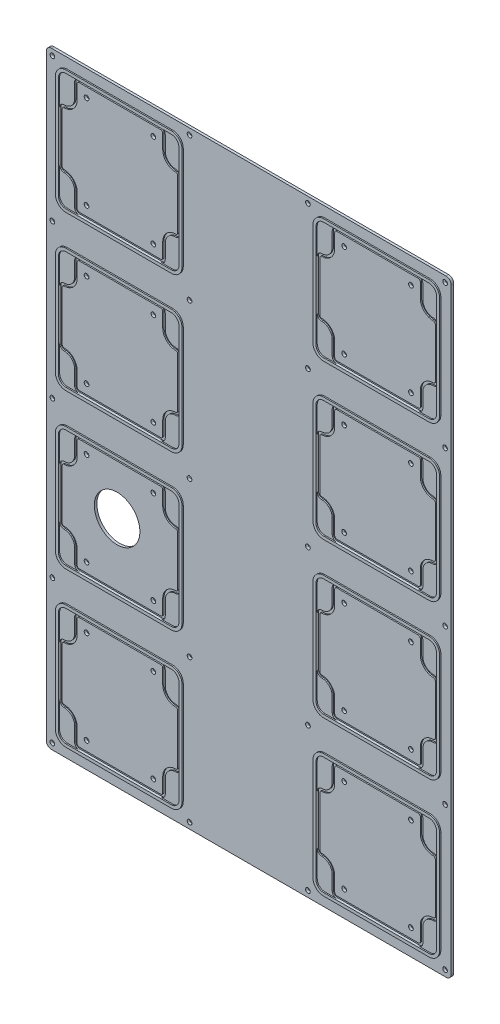
from build123d import *

# Parameters (mm, degrees)
SKETCH1_W            = 254
SKETCH1_H            = 381
BOSS_EXTRUDE1_DEPTH  = 1.5875
SKETCH2_R            = 1.4732
CUT_EXTRUDE1_DEPTH   = 458.907763809
FILLET1_R            = 3.175
CUT_EXTRUDE2_DEPTH   = 0.79375
BOSS_EXTRUDE2_DEPTH  = 0.79375
SKETCH5_R            = 1.4732
CUT_EXTRUDE3_DEPTH   = 458.907763809
LPATTERN1_COUNT      = 4
LPATTERN1_PITCH      = 96.8756
LPATTERN1_COUNT_DIR2 = 2
LPATTERN1_PITCH_DIR2 = 161.5948
SKETCH6_R            = 14.2875
CUT_EXTRUDE4_DEPTH   = 2.54


with BuildPart() as part:
    # Sketch1 → Boss-Extrude1 (new body)
    with BuildSketch(Plane.XY):
        with Locations((127, 190.5)):
            Rectangle(SKETCH1_W, SKETCH1_H)
    extrude(amount=BOSS_EXTRUDE1_DEPTH)

    # Sketch2 → Cut-Extrude1 (cut, through all)
    with BuildSketch(Plane.XY.offset(1.5875)):
        with Locations((3.81, 377.19)):
            Circle(SKETCH2_R)
        with Locations((89.8652, 377.19)):
            Circle(SKETCH2_R)
        with Locations((164.1348, 377.19)):
            Circle(SKETCH2_R)
        with Locations((250.19, 377.19)):
            Circle(SKETCH2_R)
        with Locations((164.1348, 287.375451288)):
            Circle(SKETCH2_R)
        with Locations((3.81, 287.3756)):
            Circle(SKETCH2_R)
        with Locations((250.19, 287.3756)):
            Circle(SKETCH2_R)
        with Locations((89.8652, 287.3756)):
            Circle(SKETCH2_R)
        with Locations((164.1348, 190.499990436)):
            Circle(SKETCH2_R)
        with Locations((3.81, 191.135)):
            Circle(SKETCH2_R)
        with Locations((250.19, 190.5)):
            Circle(SKETCH2_R)
        with Locations((89.8652, 190.5)):
            Circle(SKETCH2_R)
        with Locations((164.1348, 93.6244)):
            Circle(SKETCH2_R)
        with Locations((3.81, 93.6244)):
            Circle(SKETCH2_R)
        with Locations((250.19, 93.6244)):
            Circle(SKETCH2_R)
        with Locations((89.8652, 93.6244)):
            Circle(SKETCH2_R)
        with Locations((164.1348, 3.81)):
            Circle(SKETCH2_R)
        with Locations((3.81, 3.81)):
            Circle(SKETCH2_R)
        with Locations((250.19, 3.81)):
            Circle(SKETCH2_R)
        with Locations((89.8652, 3.81)):
            Circle(SKETCH2_R)
    extrude(amount=-CUT_EXTRUDE1_DEPTH, mode=Mode.SUBTRACT)

    # Fillet1
    fillet1_edges = [part.edges().sort_by_distance(p)[0] for p in [
        (254, 0, 0.79375),
        (0, 0, 0.79375),
        (254, 381, 0.79375),
        (0, 381, 0.79375),
    ]]
    fillet(fillet1_edges, radius=FILLET1_R)

    # Sketch3 → Cut-Extrude2 (cut)
    with BuildSketch(Plane.XY.offset(1.5875)):
        with BuildLine():
            Line((17.78, 79.1718), (17.78, 70.1802))
            ThreePointArc((17.78, 70.1802), (15.853172671, 65.528427329), (11.2014, 63.6016))
            ThreePointArc((11.2014, 63.6016), (9.207783141, 62.775816859), (8.382, 60.7822))
            Line((8.382, 60.7822), (8.382, 29.591))
            ThreePointArc((8.382, 29.591), (9.207783141, 27.597383141), (11.2014, 26.7716))
            ThreePointArc((11.2014, 26.7716), (15.853172671, 24.844772671), (17.78, 20.193))
            Line((17.78, 20.193), (17.78, 11.2014))
            ThreePointArc((17.78, 11.2014), (18.605783141, 9.207783141), (20.5994, 8.382))
            Line((20.5994, 8.382), (71.8058, 8.382))
            ThreePointArc((71.8058, 8.382), (73.799416859, 9.207783141), (74.6252, 11.2014))
            Line((74.6252, 11.2014), (74.6252, 20.193))
            ThreePointArc((74.6252, 20.193), (76.552027329, 24.844772671), (81.2038, 26.7716))
            ThreePointArc((81.2038, 26.7716), (83.197416859, 27.597383141), (84.0232, 29.591))
            Line((84.0232, 29.591), (84.0232, 60.7822))
            ThreePointArc((84.0232, 60.7822), (83.197416859, 62.775816859), (81.2038, 63.6016))
            ThreePointArc((81.2038, 63.6016), (76.552027329, 65.528427329), (74.6252, 70.1802))
            Line((74.6252, 70.1802), (74.6252, 79.1718))
            ThreePointArc((74.6252, 79.1718), (73.799416859, 81.165416859), (71.8058, 81.9912))
            Line((71.8058, 81.9912), (20.5994, 81.9912))
            ThreePointArc((20.5994, 81.9912), (18.605783141, 81.165416859), (17.78, 79.1718))
        make_face()
        with BuildLine():
            Line((82.4357, 29.591), (82.4357, 60.7822))
            ThreePointArc((82.4357, 60.7822), (82.074884844, 61.653284844), (81.2038, 62.0141))
            ThreePointArc((81.2038, 62.0141), (75.429495314, 64.405895314), (73.0377, 70.1802))
            Line((73.0377, 70.1802), (73.0377, 79.1718))
            ThreePointArc((73.0377, 79.1718), (72.676884844, 80.042884844), (71.8058, 80.4037))
            Line((71.8058, 80.4037), (20.5994, 80.4037))
            ThreePointArc((20.5994, 80.4037), (19.728315156, 80.042884844), (19.3675, 79.1718))
            Line((19.3675, 79.1718), (19.3675, 70.1802))
            ThreePointArc((19.3675, 70.1802), (16.975704686, 64.405895314), (11.2014, 62.0141))
            ThreePointArc((11.2014, 62.0141), (10.330315156, 61.653284844), (9.9695, 60.7822))
            Line((9.9695, 60.7822), (9.9695, 29.591))
            ThreePointArc((9.9695, 29.591), (10.330315156, 28.719915156), (11.2014, 28.3591))
            ThreePointArc((11.2014, 28.3591), (16.975704686, 25.967304686), (19.3675, 20.193))
            Line((19.3675, 20.193), (19.3675, 11.2014))
            ThreePointArc((19.3675, 11.2014), (19.728315156, 10.330315156), (20.5994, 9.9695))
            Line((20.5994, 9.9695), (71.8058, 9.9695))
            ThreePointArc((71.8058, 9.9695), (72.676884844, 10.330315156), (73.0377, 11.2014))
            Line((73.0377, 11.2014), (73.0377, 20.193))
            ThreePointArc((73.0377, 20.193), (75.429495314, 25.967304686), (81.2038, 28.3591))
            ThreePointArc((81.2038, 28.3591), (82.074884844, 28.719915156), (82.4357, 29.591))
        make_face(mode=Mode.SUBTRACT)
    cut_extrude2 = extrude(amount=-CUT_EXTRUDE2_DEPTH, mode=Mode.SUBTRACT)

    # Sketch4 → Boss-Extrude2 (add)
    with BuildSketch(Plane.XY.offset(1.5875)):
        with BuildLine():
            Line((6.477, 60.7822), (6.477, 77.2287))
            ThreePointArc((6.477, 77.2287), (8.429865536, 81.943334464), (13.1445, 83.8962))
            Line((13.1445, 83.8962), (20.5994, 83.8962))
            Line((20.5994, 83.8962), (79.2607, 83.8962))
            ThreePointArc((79.2607, 83.8962), (83.975334464, 81.943334464), (85.9282, 77.2287))
            Line((85.9282, 77.2287), (85.9282, 13.1445))
            ThreePointArc((85.9282, 13.1445), (83.975334464, 8.429865536), (79.2607, 6.477))
            Line((79.2607, 6.477), (13.1445, 6.477))
            ThreePointArc((13.1445, 6.477), (8.429865536, 8.429865536), (6.477, 13.1445))
            Line((6.477, 13.1445), (6.477, 60.7822))
        make_face()
        with BuildLine():
            Line((8.382, 60.7822), (8.382, 77.2287))
            ThreePointArc((8.382, 77.2287), (9.776903955, 80.596296045), (13.1445, 81.9912))
            Line((13.1445, 81.9912), (20.5994, 81.9912))
            Line((20.5994, 81.9912), (79.2607, 81.9912))
            ThreePointArc((79.2607, 81.9912), (82.628296045, 80.596296045), (84.0232, 77.2287))
            Line((84.0232, 77.2287), (84.0232, 13.1445))
            ThreePointArc((84.0232, 13.1445), (82.628296045, 9.776903955), (79.2607, 8.382))
            Line((79.2607, 8.382), (13.1445, 8.382))
            ThreePointArc((13.1445, 8.382), (9.776903955, 9.776903955), (8.382, 13.1445))
            Line((8.382, 13.1445), (8.382, 60.7822))
        make_face(mode=Mode.SUBTRACT)
    boss_extrude2 = extrude(amount=BOSS_EXTRUDE2_DEPTH)

    # Sketch5 → Cut-Extrude3 (cut, through all)
    with BuildSketch(Plane.XY.offset(1.5875)):
        with Locations((25.2476, 74.3966)):
            Circle(SKETCH5_R)
        with Locations((67.1576, 74.3966)):
            Circle(SKETCH5_R)
        with Locations((67.1576, 15.9766)):
            Circle(SKETCH5_R)
        with Locations((25.2476, 15.9766)):
            Circle(SKETCH5_R)
    cut_extrude3 = extrude(amount=-CUT_EXTRUDE3_DEPTH, mode=Mode.SUBTRACT)

    # LPattern1: Cut-Extrude2, Boss-Extrude2, Cut-Extrude3 4 × 2
    with Locations(*[(j * LPATTERN1_PITCH_DIR2, i * LPATTERN1_PITCH, 0) for i in range(LPATTERN1_COUNT) for j in range(LPATTERN1_COUNT_DIR2) if (i, j) != (0, 0)]):
        add(cut_extrude2, mode=Mode.SUBTRACT)
        add(boss_extrude2)
        add(cut_extrude3, mode=Mode.SUBTRACT)

    # Sketch6 → Cut-Extrude4 (cut)
    with BuildSketch(Plane.XY.offset(1.5875)):
        with Locations((44.4246, 146.0754)):
            Circle(SKETCH6_R)
    extrude(amount=-CUT_EXTRUDE4_DEPTH, mode=Mode.SUBTRACT)


solid = part.part
